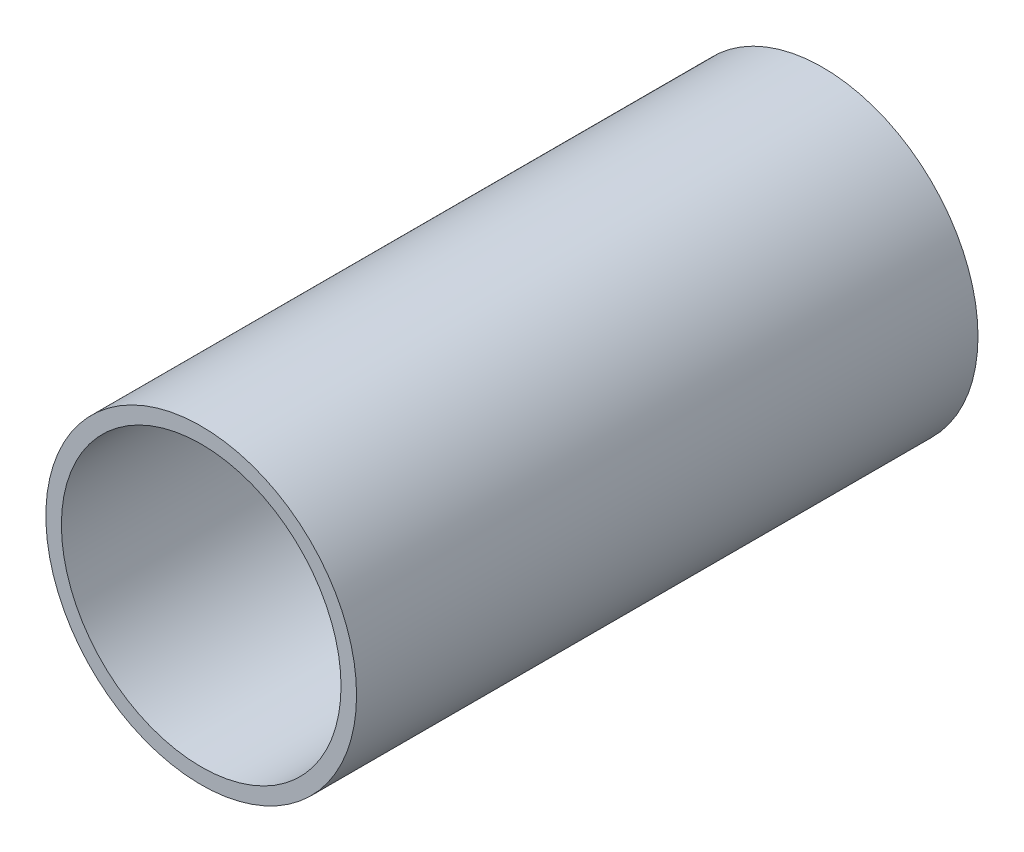
from build123d import *

# Parameters (mm, degrees)
SKETCH1_R           = 25.4
SKETCH1_R_2         = 22.86
BOSS_EXTRUDE1_DEPTH = 50.8


with BuildPart() as part:
    # Sketch1 → Boss-Extrude1 (new, symmetric)
    with BuildSketch(Plane.XY):
        Circle(SKETCH1_R)
        Circle(SKETCH1_R_2, mode=Mode.SUBTRACT)
    extrude(amount=BOSS_EXTRUDE1_DEPTH, both=True)


solid = part.part
